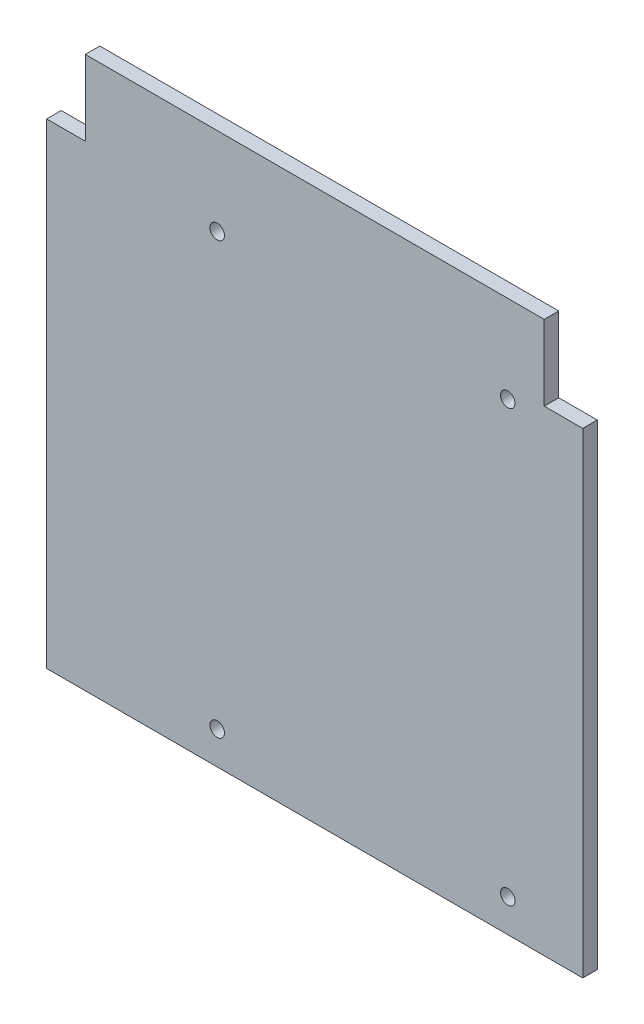
from build123d import *

# Parameters (mm, degrees)
SKETCH1_R           = 1.45
BOSS_EXTRUDE2_DEPTH = 2.9


with BuildPart() as part:
    # Sketch1 → Boss-Extrude2 (new body)
    with BuildSketch(Plane.XY):
        Polygon((-53.5, -47.5), (53.5, -47.5), (53.5, 47.5), (45.801952589, 47.5), (45.801952589, 62.5), (-45.801952589, 62.5), (-45.801952589, 47.5), (-53.5, 47.5), align=None)
        with Locations((38.536746358, -40.952272815)):
            Circle(SKETCH1_R, mode=Mode.SUBTRACT)
        with Locations((38.536746358, 45.047727185)):
            Circle(SKETCH1_R, mode=Mode.SUBTRACT)
        with Locations((-19.463253642, -40.952272815)):
            Circle(SKETCH1_R, mode=Mode.SUBTRACT)
        with Locations((-19.463253642, 45.047727185)):
            Circle(SKETCH1_R, mode=Mode.SUBTRACT)
    extrude(amount=BOSS_EXTRUDE2_DEPTH)


solid = part.part
